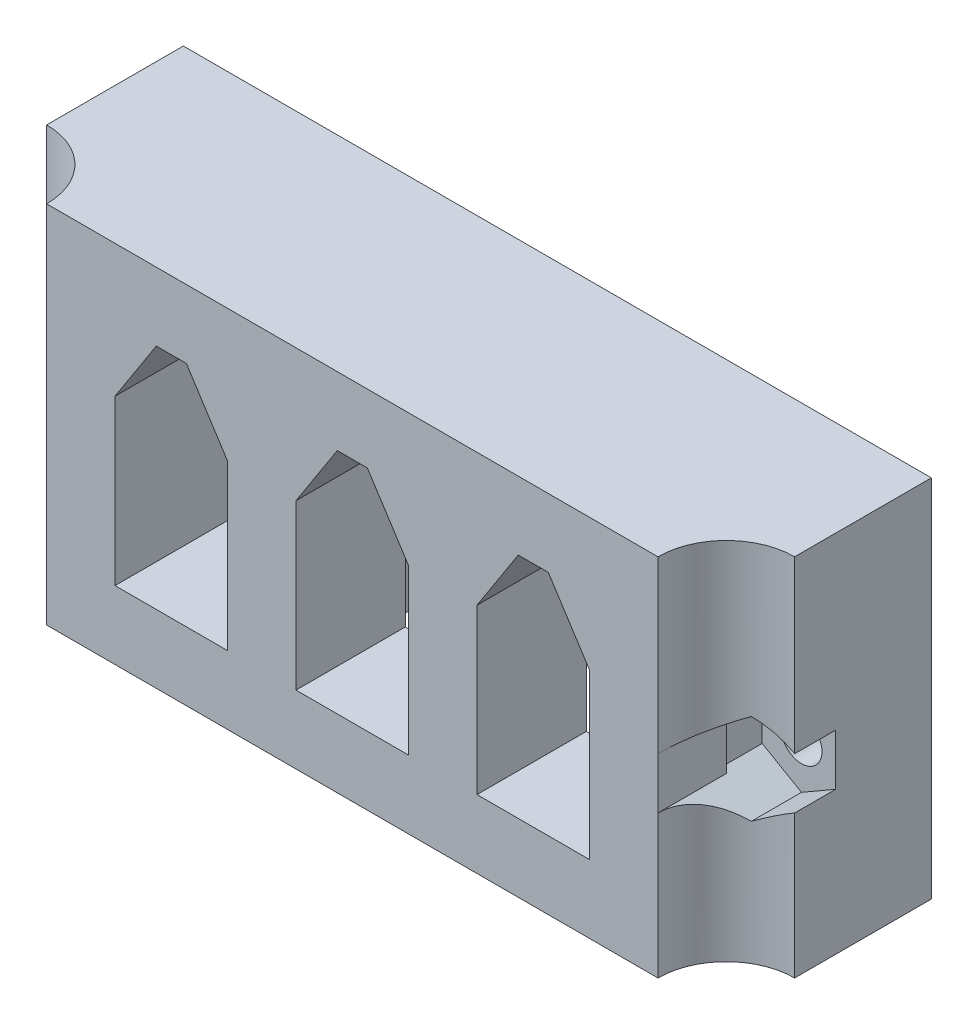
from build123d import *

# Parameters (mm, degrees)
SKETCH1_W           = 54.72
SKETCH1_H           = 26.686
BOSS_EXTRUDE1_DEPTH = 15
SKETCH2_W           = 5
SKETCH2_H           = 5
CUT_EXTRUDE1_DEPTH  = 55.19428933
SKETCH3_R           = 1.5
CUT_EXTRUDE2_DEPTH  = 25
CUT_EXTRUDE3_DEPTH  = 3
CUT_EXTRUDE5_DEPTH  = 7
FILLET2_R           = 5


with BuildPart() as part:
    # Sketch1 → Boss-Extrude1 (new body)
    with BuildSketch(Plane.XY):
        with Locations((17.36, 8.343)):
            Rectangle(SKETCH1_W, SKETCH1_H)
        Polygon((0, 0), (0, 12), (3.02, 16.686), (5.22, 16.686), (8.24, 12), (8.24, 0), align=None, mode=Mode.SUBTRACT)
        Polygon((18.46, 16.686), (21.48, 12), (21.48, 0), (13.24, 0), (13.24, 12), (16.26, 16.686), align=None, mode=Mode.SUBTRACT)
        Polygon((31.7, 16.686), (34.72, 12), (34.72, 0), (26.48, 0), (26.48, 12), (29.5, 16.686), align=None, mode=Mode.SUBTRACT)
    extrude(amount=BOSS_EXTRUDE1_DEPTH)

    # Sketch2 → Cut-Extrude1 (cut, through all)
    with BuildSketch(Plane(origin=(0, -5, 0), x_dir=(-1, 0, 0), z_dir=(0, -1, 0))):
        with Locations((7.5, -12.5)):
            Rectangle(SKETCH2_W, SKETCH2_H)
        with Locations((-42.22, -12.5)):
            Rectangle(SKETCH2_W, SKETCH2_H)
    extrude(amount=-CUT_EXTRUDE1_DEPTH, mode=Mode.SUBTRACT)

    # Sketch3 → Cut-Extrude2 (cut)
    with BuildSketch(Plane.XY.offset(10)):
        with Locations((-7.5, 7.331502285)):
            Circle(SKETCH3_R)
        with Locations((42.22, 7.331502285)):
            Circle(SKETCH3_R)
    extrude(amount=-CUT_EXTRUDE2_DEPTH, mode=Mode.SUBTRACT)

    # Sketch4 → Cut-Extrude3 (cut)
    with BuildSketch(Plane.XY.offset(10)):
        Polygon((-7.5, 10.651266332), (-10.375, 8.991384309), (-10.375, 5.671620261), (-7.5, 4.011738237), (-4.625, 5.671620261), (-4.625, 8.991384309), align=None)
        Polygon((42.22, 10.651266332), (39.345, 8.991384309), (39.345, 5.671620261), (42.22, 4.011738237), (45.095, 5.671620261), (45.095, 8.991384309), align=None)
    extrude(amount=-CUT_EXTRUDE3_DEPTH, mode=Mode.SUBTRACT)

    # Sketch7 → Cut-Extrude5 (cut)
    with BuildSketch(Plane(origin=(0, 0, 0), x_dir=(-1, 0, 0), z_dir=(0, 0, -1))):
        Polygon((0, 0), (-7.36, 0), (-7.36, -5), (-27.36, -5), (-27.36, 0), (-34.72, 0), (-34.72, 16.686), (0, 16.686), align=None)
    extrude(amount=-CUT_EXTRUDE5_DEPTH, mode=Mode.SUBTRACT)

    # Fillet2
    # the kernel refuses this fillet: 5 mm, written as the material it adds along each edge
    with BuildSketch(Plane(origin=(-5, -5, 10), x_dir=(-1, 0, 0), z_dir=(0, 1, 0))) as fillet2_piece_1_section:
        with BuildLine():
            CenterArc((FILLET2_R, FILLET2_R), FILLET2_R, 180, 90)
            Line((0, FILLET2_R), (0, 0))
            Line((0, 0), (FILLET2_R, 0))
        make_face()
    fillet2_piece_1 = extrude(amount=22.95511391, mode=Mode.PRIVATE)
    fillet2_piece_1 = split(fillet2_piece_1, bisect_by=Plane(origin=(-4.358665605, 2.198087978, 11.088883398), z_dir=(-0.5, -0.8660254037844387, 0)), keep=Keep.TOP, mode=Mode.PRIVATE)
    add(fillet2_piece_1)
    with BuildSketch(Plane(origin=(-5, -17.5, 10), x_dir=(-1, 0, 0), z_dir=(0, 1, 0))) as fillet2_piece_2_section:
        with BuildLine():
            CenterArc((FILLET2_R, FILLET2_R), FILLET2_R, 180, 90)
            Line((0, FILLET2_R), (0, 0))
            Line((0, 0), (FILLET2_R, 0))
        make_face()
    fillet2_piece_2 = extrude(amount=35.45511391, mode=Mode.PRIVATE)
    fillet2_piece_2 = split(fillet2_piece_2, bisect_by=Plane(origin=(-6.083354929, 4.82963865, 11.432065422), z_dir=(0.49999999999999967, -0.8660254037844388, 0)), keep=Keep.TOP, mode=Mode.PRIVATE)
    fillet2_piece_2 = split(fillet2_piece_2, bisect_by=Plane(origin=(-6.083354929, 3.193837824, 11.432065422), z_dir=(0.5, 0.8660254037844387, 0)), keep=Keep.TOP, mode=Mode.PRIVATE)
    add(fillet2_piece_2)
    with BuildSketch(Plane(origin=(-5, -17.5, 10), x_dir=(-1, 0, 0), z_dir=(0, 1, 0))) as fillet2_piece_3_section:
        with BuildLine():
            CenterArc((FILLET2_R, FILLET2_R), FILLET2_R, 180, 90)
            Line((0, FILLET2_R), (0, 0))
            Line((0, 0), (FILLET2_R, 0))
        make_face()
    fillet2_piece_3 = extrude(amount=35.45511391, mode=Mode.PRIVATE)
    fillet2_piece_3 = split(fillet2_piece_3, bisect_by=Plane(origin=(-6.083354929, 9.83336592, 11.432065422), z_dir=(0.5000000000000001, 0.8660254037844387, 0)), keep=Keep.TOP, mode=Mode.PRIVATE)
    add(fillet2_piece_3)
    with BuildSketch(Plane(origin=(-5, -17.5, 10), x_dir=(-1, 0, 0), z_dir=(0, 1, 0))) as fillet2_piece_4_section:
        with BuildLine():
            CenterArc((FILLET2_R, FILLET2_R), FILLET2_R, 180, 90)
            Line((0, FILLET2_R), (0, 0))
            Line((0, 0), (FILLET2_R, 0))
        make_face()
    fillet2_piece_4 = extrude(amount=35.45511391, mode=Mode.PRIVATE)
    fillet2_piece_4 = split(fillet2_piece_4, bisect_by=Plane(origin=(-8.244164443, 10.221622791, 10.130784203), z_dir=(-0.5000000000000001, 0.8660254037844387, 0)), keep=Keep.TOP, mode=Mode.PRIVATE)
    add(fillet2_piece_4)
    with BuildSketch(Plane(origin=(-5, -3.292109341, 10), x_dir=(-1, 0, 0), z_dir=(0, 1, 0))) as fillet2_piece_5_section:
        with BuildLine():
            CenterArc((FILLET2_R, FILLET2_R), FILLET2_R, 180, 90)
            Line((0, FILLET2_R), (0, 0))
            Line((0, 0), (FILLET2_R, 0))
        make_face()
    fillet2_piece_5 = extrude(amount=37.478109341, mode=Mode.PRIVATE)
    fillet2_piece_5 = split(fillet2_piece_5, bisect_by=Plane(origin=(-8.244164443, 4.441381778, 10.130784203), z_dir=(-0.5, -0.8660254037844387, 0)), keep=Keep.TOP, mode=Mode.PRIVATE)
    add(fillet2_piece_5)
    with BuildSketch(Plane(origin=(-5, -3.292109341, 10), x_dir=(-1, 0, 0), z_dir=(0, 1, 0))) as fillet2_piece_6_section:
        with BuildLine():
            CenterArc((FILLET2_R, FILLET2_R), FILLET2_R, 180, 90)
            Line((0, FILLET2_R), (0, 0))
            Line((0, 0), (FILLET2_R, 0))
        make_face()
    fillet2_piece_6 = extrude(amount=37.478109341, mode=Mode.PRIVATE)
    fillet2_piece_6 = split(fillet2_piece_6, bisect_by=Plane(origin=(-6.083354929, 4.82963865, 11.432065422), z_dir=(0.49999999999999967, -0.8660254037844388, 0)), keep=Keep.TOP, mode=Mode.PRIVATE)
    add(fillet2_piece_6)
    with BuildSketch(Plane(origin=(-5, -3.292109341, 10), x_dir=(-1, 0, 0), z_dir=(0, 1, 0))) as fillet2_piece_7_section:
        with BuildLine():
            CenterArc((FILLET2_R, FILLET2_R), FILLET2_R, 180, 90)
            Line((0, FILLET2_R), (0, 0))
            Line((0, 0), (FILLET2_R, 0))
        make_face()
    fillet2_piece_7 = extrude(amount=24.978109341, mode=Mode.PRIVATE)
    fillet2_piece_7 = split(fillet2_piece_7, bisect_by=Plane(origin=(-6.083354929, 9.83336592, 11.432065422), z_dir=(0.5000000000000001, 0.8660254037844387, 0)), keep=Keep.TOP, mode=Mode.PRIVATE)
    add(fillet2_piece_7)
    with BuildSketch(Plane(origin=(-5, -3.292109341, 10), x_dir=(-1, 0, 0), z_dir=(0, 1, 0))) as fillet2_piece_8_section:
        with BuildLine():
            CenterArc((FILLET2_R, FILLET2_R), FILLET2_R, 180, 90)
            Line((0, FILLET2_R), (0, 0))
            Line((0, 0), (FILLET2_R, 0))
        make_face()
    fillet2_piece_8 = extrude(amount=37.478109341, mode=Mode.PRIVATE)
    fillet2_piece_8 = split(fillet2_piece_8, bisect_by=Plane(origin=(-8.244164443, 11.080909874, 10.130784203), z_dir=(-0.5000000000000001, -0.8660254037844387, 0)), keep=Keep.TOP, mode=Mode.PRIVATE)
    fillet2_piece_8 = split(fillet2_piece_8, bisect_by=Plane(origin=(-8.244164443, 10.221622791, 10.130784203), z_dir=(-0.5000000000000001, 0.8660254037844387, 0)), keep=Keep.TOP, mode=Mode.PRIVATE)
    add(fillet2_piece_8)
    with BuildSketch(Plane(origin=(39.72, -3.292109341, 10), x_dir=(1, 0, 0), z_dir=(0, 1, 0))) as fillet2_piece_9_section:
        with BuildLine():
            CenterArc((FILLET2_R, -FILLET2_R), FILLET2_R, 90, 90)
            Line((0, -FILLET2_R), (0, 0))
            Line((0, 0), (FILLET2_R, 0))
        make_face()
    fillet2_piece_9 = extrude(amount=37.478109341, mode=Mode.PRIVATE)
    fillet2_piece_9 = split(fillet2_piece_9, bisect_by=Plane(origin=(42.964164443, 4.441381778, 10.130784203), z_dir=(0.4999999999999993, -0.866025403784439, 0)), keep=Keep.TOP, mode=Mode.PRIVATE)
    add(fillet2_piece_9)
    with BuildSketch(Plane(origin=(39.72, -3.292109341, 10), x_dir=(1, 0, 0), z_dir=(0, 1, 0))) as fillet2_piece_10_section:
        with BuildLine():
            CenterArc((FILLET2_R, -FILLET2_R), FILLET2_R, 90, 90)
            Line((0, -FILLET2_R), (0, 0))
            Line((0, 0), (FILLET2_R, 0))
        make_face()
    fillet2_piece_10 = extrude(amount=37.478109341, mode=Mode.PRIVATE)
    fillet2_piece_10 = split(fillet2_piece_10, bisect_by=Plane(origin=(40.803354929, 4.82963865, 11.432065422), z_dir=(-0.5000000000000001, -0.8660254037844386, 0)), keep=Keep.TOP, mode=Mode.PRIVATE)
    add(fillet2_piece_10)
    with BuildSketch(Plane(origin=(39.72, -3.292109341, 10), x_dir=(1, 0, 0), z_dir=(0, 1, 0))) as fillet2_piece_11_section:
        with BuildLine():
            CenterArc((FILLET2_R, -FILLET2_R), FILLET2_R, 90, 90)
            Line((0, -FILLET2_R), (0, 0))
            Line((0, 0), (FILLET2_R, 0))
        make_face()
    fillet2_piece_11 = extrude(amount=24.978109341, mode=Mode.PRIVATE)
    fillet2_piece_11 = split(fillet2_piece_11, bisect_by=Plane(origin=(40.803354929, 9.83336592, 11.432065422), z_dir=(-0.5, 0.8660254037844387, 0)), keep=Keep.TOP, mode=Mode.PRIVATE)
    add(fillet2_piece_11)
    with BuildSketch(Plane(origin=(39.72, -3.292109341, 10), x_dir=(1, 0, 0), z_dir=(0, 1, 0))) as fillet2_piece_12_section:
        with BuildLine():
            CenterArc((FILLET2_R, -FILLET2_R), FILLET2_R, 90, 90)
            Line((0, -FILLET2_R), (0, 0))
            Line((0, 0), (FILLET2_R, 0))
        make_face()
    fillet2_piece_12 = extrude(amount=37.478109341, mode=Mode.PRIVATE)
    fillet2_piece_12 = split(fillet2_piece_12, bisect_by=Plane(origin=(42.964164443, 11.080909874, 10.130784203), z_dir=(0.5, -0.8660254037844387, 0)), keep=Keep.TOP, mode=Mode.PRIVATE)
    fillet2_piece_12 = split(fillet2_piece_12, bisect_by=Plane(origin=(42.964164443, 10.221622791, 10.130784203), z_dir=(0.4999999999999985, 0.8660254037844396, 0)), keep=Keep.TOP, mode=Mode.PRIVATE)
    add(fillet2_piece_12)
    with BuildSketch(Plane(origin=(39.72, -5, 10), x_dir=(0, 0, 1), z_dir=(0, 1, 0))) as fillet2_piece_13_section:
        with BuildLine():
            CenterArc((FILLET2_R, FILLET2_R), FILLET2_R, 180, 90)
            Line((0, FILLET2_R), (0, 0))
            Line((0, 0), (FILLET2_R, 0))
        make_face()
    fillet2_piece_13 = extrude(amount=22.95511391, mode=Mode.PRIVATE)
    fillet2_piece_13 = split(fillet2_piece_13, bisect_by=Plane(origin=(39.078665605, 2.198087978, 11.088883398), z_dir=(0.4999999999999993, -0.866025403784439, 0)), keep=Keep.TOP, mode=Mode.PRIVATE)
    add(fillet2_piece_13)
    with BuildSketch(Plane(origin=(39.72, -17.5, 10), x_dir=(0, 0, 1), z_dir=(0, 1, 0))) as fillet2_piece_14_section:
        with BuildLine():
            CenterArc((FILLET2_R, FILLET2_R), FILLET2_R, 180, 90)
            Line((0, FILLET2_R), (0, 0))
            Line((0, 0), (FILLET2_R, 0))
        make_face()
    fillet2_piece_14 = extrude(amount=35.45511391, mode=Mode.PRIVATE)
    fillet2_piece_14 = split(fillet2_piece_14, bisect_by=Plane(origin=(40.803354929, 4.82963865, 11.432065422), z_dir=(-0.5000000000000001, -0.8660254037844386, 0)), keep=Keep.TOP, mode=Mode.PRIVATE)
    fillet2_piece_14 = split(fillet2_piece_14, bisect_by=Plane(origin=(40.803354929, 3.193837824, 11.432065422), z_dir=(-0.4999999999999993, 0.866025403784439, 0)), keep=Keep.TOP, mode=Mode.PRIVATE)
    add(fillet2_piece_14)
    with BuildSketch(Plane(origin=(39.72, -17.5, 10), x_dir=(0, 0, 1), z_dir=(0, 1, 0))) as fillet2_piece_15_section:
        with BuildLine():
            CenterArc((FILLET2_R, FILLET2_R), FILLET2_R, 180, 90)
            Line((0, FILLET2_R), (0, 0))
            Line((0, 0), (FILLET2_R, 0))
        make_face()
    fillet2_piece_15 = extrude(amount=35.45511391, mode=Mode.PRIVATE)
    fillet2_piece_15 = split(fillet2_piece_15, bisect_by=Plane(origin=(42.964164443, 10.221622791, 10.130784203), z_dir=(0.4999999999999985, 0.8660254037844396, 0)), keep=Keep.TOP, mode=Mode.PRIVATE)
    add(fillet2_piece_15)
    with BuildSketch(Plane(origin=(39.72, -17.5, 10), x_dir=(0, 0, 1), z_dir=(0, 1, 0))) as fillet2_piece_16_section:
        with BuildLine():
            CenterArc((FILLET2_R, FILLET2_R), FILLET2_R, 180, 90)
            Line((0, FILLET2_R), (0, 0))
            Line((0, 0), (FILLET2_R, 0))
        make_face()
    fillet2_piece_16 = extrude(amount=35.45511391, mode=Mode.PRIVATE)
    fillet2_piece_16 = split(fillet2_piece_16, bisect_by=Plane(origin=(40.803354929, 9.833365919, 11.432065422), z_dir=(-0.5, 0.8660254037844387, 0)), keep=Keep.TOP, mode=Mode.PRIVATE)
    add(fillet2_piece_16)


solid = part.part
